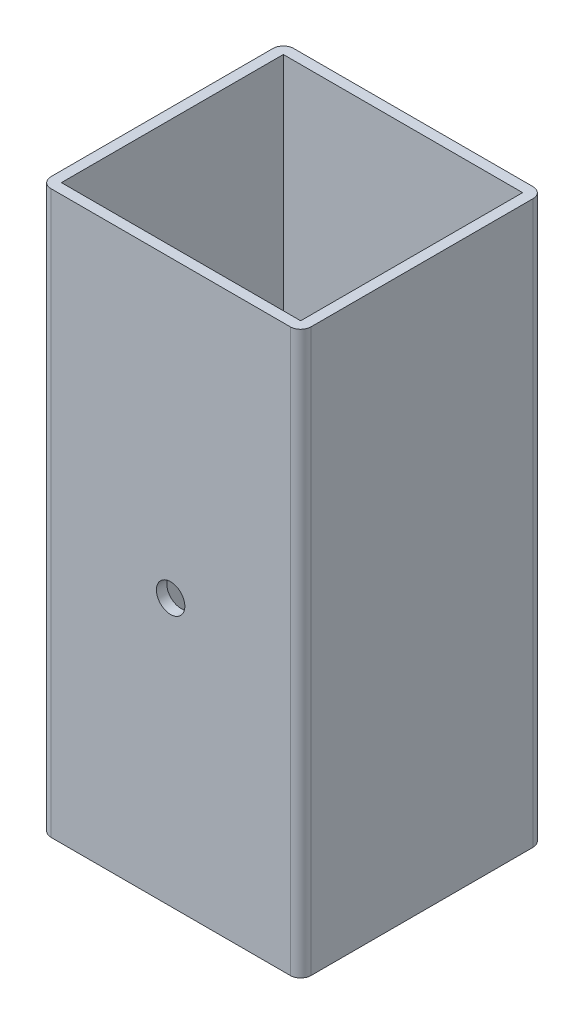
from build123d import *

# Parameters (mm, degrees)
SKETCH_1_W         = 75
SKETCH_1_H         = 162
BLOCKEXTRUDE_DEPTH = 70
FILLET_2_R         = 3
SHELL_START        = 3
SHELL_1_OUTLINE_W  = 159
SHELL_1_OUTLINE_H  = 64
SHELL_1_DEPTH      = 69
SKETCH_2_R         = 4.1
CABLE_ENTRY_DEPTH  = 192.752444574


# Read off the part's stored shape, not the designer's step: 抽壳1
with BuildPart() as part:
    # 草图1 → BlockExtrude (new body)
    with BuildSketch(Plane.XY):
        with Locations((37.5, 81)):
            Rectangle(SKETCH_1_W, SKETCH_1_H)
    extrude(amount=BLOCKEXTRUDE_DEPTH)

    # Fillet 2
    fillet_2_edges = [part.edges().sort_by_distance(p)[0] for p in [
        (75, 81, 70),
        (0, 81, 70),
        (75, 81, 0),
        (0, 81, 0),
    ]]
    fillet(fillet_2_edges, radius=FILLET_2_R)

    # 抽壳1 outline → 抽壳1 (cut)
    with BuildSketch(Plane.YZ.offset(SHELL_START)):
        with Locations((82.5, 35)):
            Rectangle(SHELL_1_OUTLINE_W, SHELL_1_OUTLINE_H)
    extrude(amount=SHELL_1_DEPTH, mode=Mode.SUBTRACT)

    # 草图2 → Cable_entry (cut, through all)
    with BuildSketch(Plane(origin=(0, 0, 0), x_dir=(-1, 0, 0), z_dir=(0, 0, -1))):
        with Locations((-37.5, 77)):
            Circle(SKETCH_2_R)
    extrude(amount=-CABLE_ENTRY_DEPTH, mode=Mode.SUBTRACT)


solid = part.part
